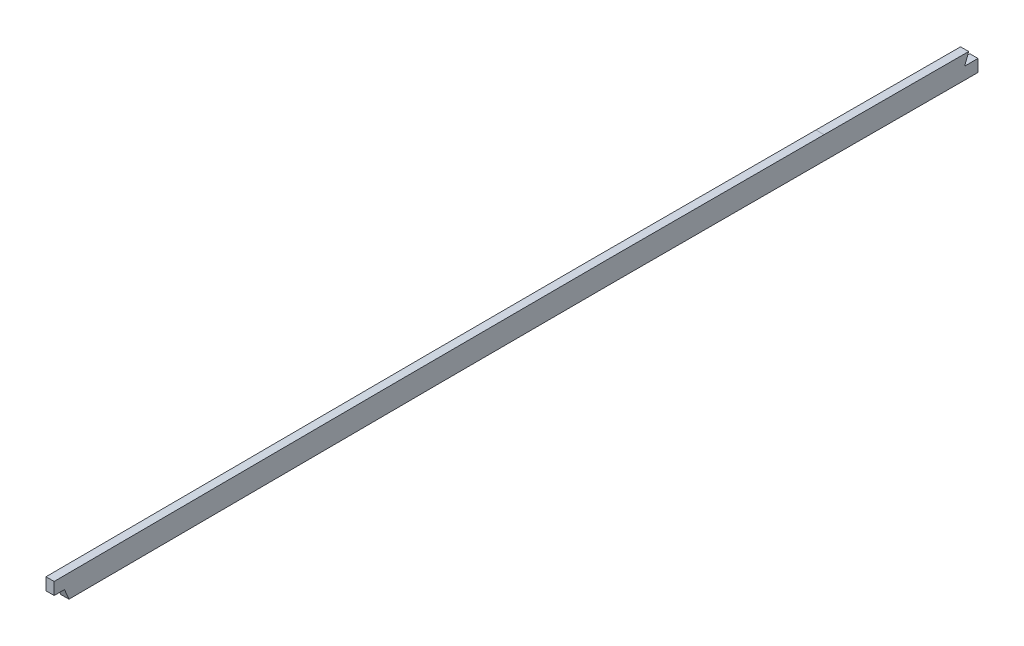
from build123d import *

# Parameters (mm, degrees)
BOSS_EXTRUDE1_START = -1.5875
BOSS_EXTRUDE1_DEPTH = 3.175
FILLET1_R           = 2.54
CUT_EXTRUDE1_DEPTH  = 2674.191025632
FILLET2_R           = 0.762
FILLET3_R           = 0.762
CUT_EXTRUDE2_DEPTH  = 7.62


with BuildPart() as part:
    # Boss-Extrude1: read off the stored shape, not the designer's step
    # Boss-Extrude1 outline → Boss-Extrude1 (new body)
    with BuildSketch(Plane(origin=(0, 0, 0), x_dir=(0, 0, -1), z_dir=(1, 0, 0)).offset(BOSS_EXTRUDE1_START)):
        with BuildLine():
            add(Edge.make_bspline(
                [(1110.404970926, 130.384545774), (1120.170834465, 130.370061323), (1139.703057908, 130.338772026), (1168.998370974, 130.277673039), (1198.290610395, 130.194386876), (1217.81419633, 130.113940836), (1227.576506903, 130.06508052)],
                knots=[0, 0, 0, 0, 0.25, 0.5, 0.75, 1, 1, 1, 1], degree=3))
            add(Edge.make_bspline(
                [(1227.576506903, 130.06508052), (1269.911205773, 129.853195249), (1333.427746701, 129.273373321), (1418.042208161, 127.449050563), (1502.665994832, 124.913583682), (1608.454176987, 120.803299479), (1693.070073331, 116.848243245), (1735.369787733, 114.744712179)],
                knots=[0, 0, 0, 0, 0.25, 0.375, 0.5, 0.75, 1, 1, 1, 1], degree=3))
            add(Edge.make_bspline(
                [(1735.369787733, 114.744712179), (1815.995940723, 110.735232018), (1936.906650462, 104.096364548), (2098.049485168, 94.18797875), (2198.694736725, 87.314638509), (2279.130413747, 81.114418931), (2339.412950304, 76.034076608), (2399.564054334, 70.28270545), (2479.570468264, 61.127378254), (2559.292087872, 49.650907614), (2626.797554585, 38.235484735), (2656.889518578, 32.788503969), (2667.159793662, 30.877771266), (2669.54, 30.432069924)],
                knots=[0, 0, 0, 0, 0.25, 0.375, 0.5, 0.5625, 0.625, 0.6875, 0.75, 0.875, 0.9375, 0.96241067, 0.969928536, 0.969928536, 0.969928536, 0.969928536], degree=3))
            Line((2669.54, 30.432069924), (2669.54, 39.476142465))
            add(Edge.make_bspline(
                [(1735.811334709, 123.623740069), (1776.138635499, 121.618292624), (1816.460281579, 119.500621806), (1897.093668675, 115.087561885), (1937.405638896, 112.792971084), (2018.018419045, 108.018366523), (2058.319512223, 105.539122976), (2138.903780144, 100.307240032), (2179.18739793, 97.555127955), (2239.586998714, 93.080168687), (2259.716280977, 91.529837622), (2289.900442602, 89.09084343), (2299.960179135, 88.258845039), (2320.076004566, 86.552861654), (2330.132100898, 85.678962223), (2350.239356518, 83.874334847), (2360.290489794, 82.943307484), (2380.385973971, 81.003183297), (2390.430065378, 79.993418555), (2420.547026195, 76.827577532), (2440.60648589, 74.533672955), (2480.675569568, 69.556278523), (2500.68715183, 66.874150811), (2540.654290207, 61.150246295), (2560.611026428, 58.109755646), (2600.475457131, 51.702465574), (2620.382967089, 48.337538888), (2650.028116889, 43.072156367), (2659.78844051, 41.29687683), (2669.54, 39.476142465)],
                knots=[0, 0, 0, 0, 0.125, 0.125, 0.25, 0.25, 0.375, 0.375, 0.5, 0.5, 0.5625, 0.5625, 0.59375, 0.59375, 0.625, 0.625, 0.65625, 0.65625, 0.6875, 0.6875, 0.75, 0.75, 0.8125, 0.8125, 0.875, 0.875, 0.9375, 0.9375, 0.968210768, 0.968210768, 0.968210768, 0.968210768], degree=3))
            add(Edge.make_bspline(
                [(1227.621000751, 138.954969175), (1248.807303679, 138.848931677), (1269.993583155, 138.701170252), (1312.363832348, 138.270664618), (1333.547719008, 137.987407832), (1375.912368189, 137.249274813), (1397.09309738, 136.7925677), (1439.451328259, 135.701855835), (1460.629010312, 135.069210584), (1502.979101161, 133.670541385), (1524.152152736, 132.907434339), (1566.494303759, 131.284732459), (1587.663166024, 130.423163385), (1651.164052809, 127.709123983), (1693.490421561, 125.728325331), (1735.811334709, 123.623740069)],
                knots=[0, 0, 0, 0, 0.125, 0.125, 0.25, 0.25, 0.375, 0.375, 0.5, 0.5, 0.625, 0.625, 0.75, 0.75, 1, 1, 1, 1], degree=3))
            add(Edge.make_bspline(
                [(1110.418156307, 139.274535996), (1129.952027249, 139.245563914), (1149.485893504, 139.211997476), (1188.553558893, 139.115899087), (1208.087346834, 139.052735015), (1227.621000751, 138.954969175)],
                knots=[0, 0, 0, 0, 0.5, 0.5, 1, 1, 1, 1], degree=3))
            add(Edge.make_bspline(
                [(768.740124165, 138.468408213), (782.976796045, 138.460280143), (797.213453801, 138.479500079), (825.686695051, 138.549690296), (839.923258916, 138.600062665), (868.396318956, 138.719026333), (882.632808962, 138.789607972), (911.105746117, 138.939594729), (925.342197007, 139.018479563), (953.81517223, 139.160090703), (968.051699178, 139.222241505), (996.524919377, 139.30995407), (1010.761605517, 139.335014039), (1039.234912871, 139.349647552), (1053.471562869, 139.340493535), (1081.944860968, 139.313691902), (1096.181508981, 139.29565137), (1110.418156307, 139.274535996)],
                knots=[0, 0, 0, 0, 0.125, 0.125, 0.25, 0.25, 0.375, 0.375, 0.5, 0.5, 0.625, 0.625, 0.75, 0.75, 0.875, 0.875, 1, 1, 1, 1], degree=3))
            add(Edge.make_bspline(
                [(630.778432202, 139.251437536), (653.771819614, 139.075315664), (676.765000849, 138.871740519), (711.255349111, 138.647690701), (722.752238945, 138.586174182), (745.746099074, 138.499784896), (757.243084259, 138.474972158), (768.740124165, 138.468408213)],
                knots=[0, 0, 0, 0, 0.5, 0.5, 0.75, 0.75, 1, 1, 1, 1], degree=3))
            add(Edge.make_bspline(
                [(604.514984259, 139.433685568), (609.940743136, 139.400696354), (618.695242427, 139.342071397), (627.449694696, 139.276935028), (630.778432202, 139.251437536)],
                knots=[0, 0, 0, 0, 0.619765686, 1, 1, 1, 1], degree=3))
            ThreePointArc((604.514984259, 139.433685568), (600.549356142, 139.457173081), (596.583720644, 139.479379304))
            add(Edge.make_bspline(
                [(436.133018826, 139.357176562), (449.50393779, 139.390650739), (462.874888934, 139.412366015), (489.61665939, 139.498555977), (502.987497127, 139.559076553), (529.729299233, 139.628029754), (543.100240501, 139.639230481), (569.84212102, 139.601013959), (583.212960696, 139.552035302), (596.583720644, 139.479379304)],
                knots=[0, 0, 0, 0, 0.25, 0.25, 0.5, 0.5, 0.75, 0.75, 1, 1, 1, 1], degree=3))
            add(Edge.make_bspline(
                [(432.263917423, 139.347117104), (433.553617637, 139.350567112), (434.843318039, 139.353947814), (436.133018826, 139.357176562)],
                knots=[0, 0, 0, 0, 1, 1, 1, 1], degree=3))
            add(Edge.make_bspline(
                [(420.316232014, 139.305761868), (422.413235913, 139.315186344), (426.395793967, 139.330351666), (430.378363115, 139.342073082), (432.263917423, 139.347117104)],
                knots=[0, 0, 0, 0, 0.526548575, 1, 1, 1, 1], degree=3))
            add(Edge.make_bspline(
                [(376.410119779, 138.75403864), (383.726317086, 138.935561778), (391.043801196, 139.055611797), (405.679602634, 139.224192856), (412.997895507, 139.272871444), (420.316232014, 139.305761868)],
                knots=[0, 0, 0, 0, 0.5, 0.5, 1, 1, 1, 1], degree=3))
            add(Edge.make_bspline(
                [(336.49221538, 137.002990798), (349.782924989, 137.88646357), (363.094318653, 138.423658969), (376.410119779, 138.75403864)],
                knots=[0, 0, 0, 0, 1, 1, 1, 1], degree=3))
            add(Edge.make_bspline(
                [(322.369488076, 135.928469458), (327.073374868, 136.333386449), (331.781331813, 136.689844531), (336.49221538, 137.002990798)],
                knots=[0, 0, 0, 0, 1, 1, 1, 1], degree=3))
            add(Edge.make_bspline(
                [(269.769949315, 129.47895505), (274.123387467, 130.231879276), (278.485668028, 130.925946417), (287.22796256, 132.196043087), (291.608626646, 132.771988738), (300.381777496, 133.818422146), (304.774579419, 134.288963443), (313.567800313, 135.154375086), (317.967903853, 135.549407043), (322.369488076, 135.928469458)],
                knots=[0, 0, 0, 0, 0.25, 0.25, 0.5, 0.5, 0.75, 0.75, 1, 1, 1, 1], degree=3))
            add(Edge.make_bspline(
                [(135.15718457, 90.054634926), (146.043739673, 94.375230064), (156.99891695, 98.504335222), (173.56622243, 104.322560697), (179.110932848, 106.199810145), (190.24859245, 109.819698901), (195.841545849, 111.562316625), (207.065472514, 114.901345648), (212.697969124, 116.49836249), (224.005973618, 119.540534541), (229.683240596, 120.9862349), (246.767187276, 125.077694043), (258.225188059, 127.482295924), (269.769949315, 129.47895505)],
                knots=[0, 0, 0, 0, 0.25, 0.25, 0.375, 0.375, 0.5, 0.5, 0.625, 0.625, 0.75, 0.75, 1, 1, 1, 1], degree=3))
            add(Edge.make_bspline(
                [(107.049744533, 78.466050261), (116.373258882, 82.438606419), (125.737350123, 86.316143859), (135.15718457, 90.054634926)],
                knots=[0, 0, 0, 0, 1, 1, 1, 1], degree=3))
            add(Edge.make_bspline(
                [(99.06, 75.03568963), (99.223542669, 75.106424562), (100.635498802, 75.716852689), (103.297453866, 76.863328103), (105.798503999, 77.932922637), (107.049744533, 78.466050261)],
                knots=[0.484151133, 0.484151133, 0.484151133, 0.484151133, 0.515864471, 0.757931449, 1, 1, 1, 1], degree=3))
            Line((99.06, 75.03568963), (99.06, 65.345043949))
            add(Edge.make_bspline(
                [(99.06, 65.345043949), (99.380370965, 65.484464523), (100.637671455, 66.031176319), (103.17753745, 67.132002814), (106.681577323, 68.64166857), (109.249580285, 69.740028797), (110.534459652, 70.287489229)],
                knots=[0.254738807, 0.254738807, 0.254738807, 0.254738807, 0.317238807, 0.5, 0.75, 1, 1, 1, 1], degree=3))
            add(Edge.make_bspline(
                [(110.534459652, 70.287489229), (112.850658013, 71.274373329), (117.489277519, 73.236837099), (124.456688526, 76.138068453), (131.438476528, 78.994265342), (136.101204469, 80.864754132), (138.436571012, 81.791601309)],
                knots=[0, 0, 0, 0, 0.25, 0.5, 0.75, 1, 1, 1, 1], degree=3))
            add(Edge.make_bspline(
                [(138.436571012, 81.791601309), (143.826897197, 83.930883835), (154.6522834, 88.11877139), (176.408203186, 96.037596764), (203.906835742, 104.998187521), (237.39469787, 114.027149543), (259.934818065, 118.755998441), (271.284977744, 120.719001348)],
                knots=[0, 0, 0, 0, 0.125, 0.25, 0.5, 0.75, 1, 1, 1, 1], degree=3))
            add(Edge.make_bspline(
                [(271.284977744, 120.719001348), (275.558711595, 121.458140765), (284.124297478, 122.821139095), (297.036360548, 124.518896272), (310.018420247, 125.909880891), (318.766623126, 126.695286194), (323.13209925, 127.071239405)],
                knots=[5e-09, 5e-09, 5e-09, 5e-09, 0.2499992, 0.4999984, 0.7499976, 0.999996801, 0.999996801, 0.999996801, 0.999996801], degree=3))
            add(Edge.make_bspline(
                [(323.13209925, 127.071239405), (324.293050056, 127.171175344), (326.615168427, 127.365043892), (330.101568176, 127.638529754), (333.590184216, 127.895089457), (335.917953069, 128.055198639), (337.081858513, 128.132566852)],
                knots=[1.2024e-05, 1.2024e-05, 1.2024e-05, 1.2024e-05, 0.250009018, 0.500006012, 0.750003006, 1, 1, 1, 1], degree=3))
            add(Edge.make_bspline(
                [(337.081858513, 128.132566852), (340.367862287, 128.350997241), (346.939906877, 128.744909116), (356.821319657, 129.221190111), (366.716250393, 129.595096292), (373.326613137, 129.784797569), (376.630622597, 129.866773678)],
                knots=[0, 0, 0, 0, 0.25, 0.5, 0.75, 1, 1, 1, 1], degree=3))
            add(Edge.make_bspline(
                [(376.630622597, 129.866773678), (380.266394474, 129.956981294), (387.534764147, 130.106779908), (398.462206547, 130.259361028), (409.400972015, 130.358727994), (416.705417778, 130.39944419), (420.356185481, 130.415851648)],
                knots=[0, 0, 0, 0, 0.25, 0.5, 0.75, 1, 1, 1, 1], degree=3))
            add(Edge.make_bspline(
                [(420.356185481, 130.415851648), (421.350045129, 130.420318309), (423.337533562, 130.428603137), (426.320174328, 130.439402209), (429.303468332, 130.448883952), (431.293011648, 130.454488038), (432.287698861, 130.457148912)],
                knots=[0, 0, 0, 0, 0.25, 0.5, 0.75, 1, 1, 1, 1], degree=3))
            add(Edge.make_bspline(
                [(432.287698861, 130.457148912), (432.610032304, 130.45801117), (433.254717136, 130.45972707), (434.221637716, 130.462266911), (435.188505114, 130.464765142), (435.833012253, 130.466397641), (436.155274747, 130.46720442)],
                knots=[9.2e-08, 9.2e-08, 9.2e-08, 9.2e-08, 0.25, 0.5, 0.75, 1, 1, 1, 1], degree=3))
            add(Edge.make_bspline(
                [(436.155274747, 130.46720442), (449.528322363, 130.500683927), (476.275740382, 130.546633815), (516.38896029, 130.728798697), (556.456290895, 130.759667498), (583.176533448, 130.662101975), (596.535396133, 130.589510646)],
                knots=[0, 0, 0, 0, 0.249999973, 0.499999946, 0.749999918, 0.999999891, 0.999999891, 0.999999891, 0.999999891], degree=3))
            ThreePointArc((596.535396133, 130.589510646), (600.498158983, 130.567320504), (604.460914457, 130.543849998))
            add(Edge.make_bspline(
                [(604.460914457, 130.543849998), (606.648150431, 130.530551362), (611.022503017, 130.502867011), (617.584689429, 130.458405465), (624.147187284, 130.411339888), (628.522663802, 130.378455494), (630.7103385, 130.361698324)],
                knots=[-7.09e-07, -7.09e-07, -7.09e-07, -7.09e-07, 0.249999468, 0.499999646, 0.749999823, 1, 1, 1, 1], degree=3))
            add(Edge.make_bspline(
                [(630.7103385, 130.361698324), (642.206126489, 130.273644326), (665.193556095, 130.083785311), (699.699077953, 129.819212193), (734.21504011, 129.634735151), (757.228597075, 129.58497898), (768.735048644, 129.578409662)],
                knots=[0, 0, 0, 0, 0.25, 0.5, 0.75, 1, 1, 1, 1], degree=3))
            add(Edge.make_bspline(
                [(768.735048644, 129.578409662), (797.222409768, 129.56214552), (854.203652026, 129.725124503), (939.635195481, 130.236578518), (1024.992958464, 130.524931921), (1081.937612336, 130.426767717), (1110.404970926, 130.384545774)],
                knots=[0, 0, 0, 0, 0.25, 0.5, 0.75, 1, 1, 1, 1], degree=3))
        make_face()
    extrude(amount=BOSS_EXTRUDE1_DEPTH)

    # Fillet1
    fillet1_edges = [part.edges().sort_by_distance(p)[0] for p in [
        (0, 39.476142465, -2669.54),
        (0, 30.432069924, -2669.54),
        (0, 65.345043949, -99.06),
        (0, 75.03568963, -99.06),
    ]]
    fillet(fillet1_edges, radius=FILLET1_R)

    # Sketch4 → Cut-Extrude1 (cut, through all)
    with BuildSketch(Plane(origin=(1.5875, 0, 0), x_dir=(0, 0, -1), z_dir=(1, 0, 0))):
        Polygon((1827.2125, 118.895836595), (1827.2125, 110.000384115), (1827.2125, 78.791710134), (2135.1875, 78.791710134), (2135.1875, 91.599357392), (2135.1875, 100.508307819), (2135.1875, 129.353842083), (1827.2125, 129.353842083), align=None)
    extrude(amount=-CUT_EXTRUDE1_DEPTH, mode=Mode.SUBTRACT)


with BuildPart() as cut_extrude1_piece_1:
    # of the separate pieces the step leaves, piece 1, a body of its own (cut_extrude1_pieces)
    add(part.part.solids().sort_by_distance((-1.5875, 114.744712179, -1735.369787733))[0])

    # Fillet2
    fillet2_edges = [cut_extrude1_piece_1.edges().sort_by_distance(p)[0] for p in [
        (0, 118.895836595, -1827.2125),
        (0, 110.000384116, -1827.2125),
    ]]
    fillet(fillet2_edges, radius=FILLET2_R)


with BuildPart() as cut_extrude1_piece_2:
    # of the separate pieces the step leaves, piece 2, a body of its own (cut_extrude1_pieces)
    add(part.part.solids().sort_by_distance((-1.5875, 91.599357392, -2135.1875))[0])

    # Fillet3
    fillet3_edges = [cut_extrude1_piece_2.edges().sort_by_distance(p)[0] for p in [
        (0, 100.508307819, -2135.1875),
        (0, 91.599357392, -2135.1875),
    ]]
    fillet(fillet3_edges, radius=FILLET3_R)


with BuildPart() as cut_extrude2_tool:
    # Sketch5 → Cut-Extrude2 (new body)
    with BuildSketch(Plane(origin=(1.5875, 0, 0), x_dir=(0, 0, -1), z_dir=(1, 0, 0))):
        Polygon((810.468029574, 138.512199639), (810.468029574, 133.759282778), (814.491468237, 133.759282778), (816.238424635, 129.632745348), (816.238424635, 106.608138071), (55.182537973, 0), (26.685618653, 153.088449224), (810.468029574, 153.088449224), align=None)
        Polygon((1166.769177473, 139.169420645), (1165.186656638, 135.018963115), (1170.386904229, 135.018963115), (1170.386904229, 130.270526743), (1170.386904229, 114.196578451), (2691.040068031, -74.953739753), (2732.471219555, 153.088449224), (1166.769177473, 153.088449224), align=None)
    extrude(amount=-CUT_EXTRUDE2_DEPTH)


with BuildPart() as cut_extrude1_piece_1_1:
    add(cut_extrude1_piece_1.part)

    # Cut-Extrude2: cut by cut_extrude2_tool
    add(cut_extrude2_tool.part, mode=Mode.SUBTRACT)


with BuildPart() as cut_extrude1_piece_2_1:
    add(cut_extrude1_piece_2.part)

    # Cut-Extrude2: cut by cut_extrude2_tool
    add(cut_extrude2_tool.part, mode=Mode.SUBTRACT)


solid = cut_extrude1_piece_1_1.part
